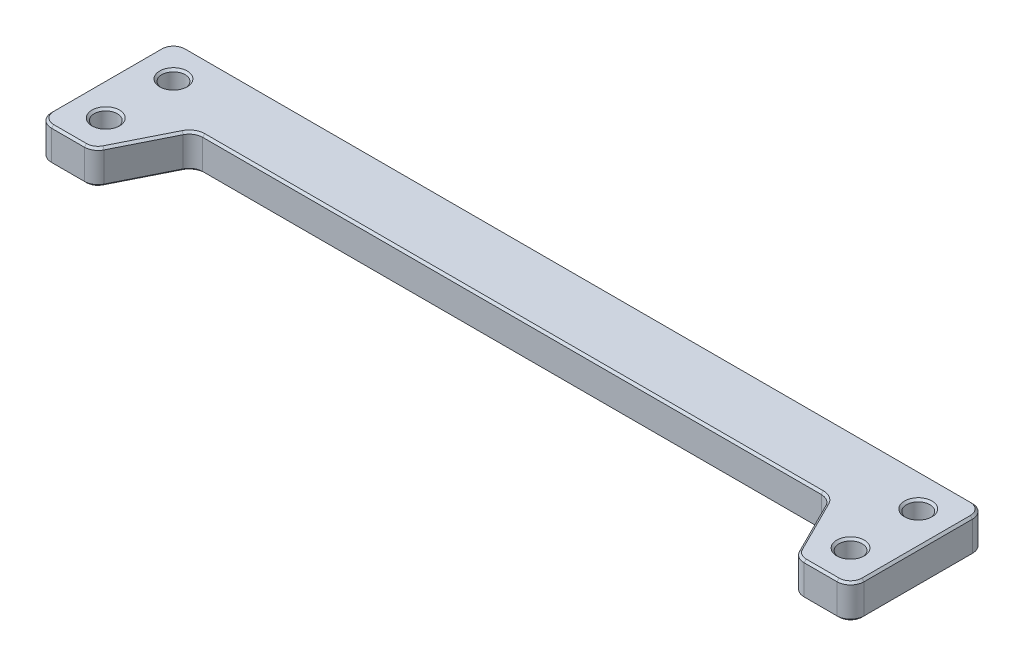
from build123d import *

# Parameters (mm, degrees)
SKETCH1_R           = 2.1828125
BOSS_EXTRUDE1_DEPTH = 6.35
CHAMFER1_SIZE       = 0.396875


with BuildPart() as part:
    # Sketch1 → Boss-Extrude1 (new body)
    with BuildSketch(Plane(origin=(0, 0, 0), x_dir=(1, 0, 0), z_dir=(0, 1, 0))):
        with BuildLine():
            Line((-3.81, 19.05), (143.51, 19.05))
            ThreePointArc((143.51, 19.05), (145.306051224, 18.306051224), (146.05, 16.51))
            Line((146.05, 16.51), (146.05, -3.81))
            ThreePointArc((146.05, -3.81), (145.306051224, -5.606051224), (143.51, -6.35))
            Line((143.51, -6.35), (137.345290503, -6.35))
            ThreePointArc((137.345290503, -6.35), (136.009933478, -5.970653053), (135.073445438, -4.945922533))
            Line((135.073445438, -4.945922533), (130.127522905, 4.945922533))
            ThreePointArc((130.127522905, 4.945922533), (129.191034865, 5.970653053), (127.85567784, 6.35))
            Line((127.85567784, 6.35), (11.84432216, 6.35))
            ThreePointArc((11.84432216, 6.35), (10.508965135, 5.970653053), (9.572477095, 4.945922533))
            Line((9.572477095, 4.945922533), (4.626554562, -4.945922533))
            ThreePointArc((4.626554562, -4.945922533), (3.690066522, -5.970653053), (2.354709497, -6.35))
            Line((2.354709497, -6.35), (-3.81, -6.35))
            ThreePointArc((-3.81, -6.35), (-5.606051224, -5.606051224), (-6.35, -3.81))
            Line((-6.35, -3.81), (-6.35, 16.51))
            ThreePointArc((-6.35, 16.51), (-5.606051224, 18.306051224), (-3.81, 19.05))
        make_face()
        Circle(SKETCH1_R, mode=Mode.SUBTRACT)
        with Locations((0, 12.7)):
            Circle(SKETCH1_R, mode=Mode.SUBTRACT)
        with Locations((139.7, 12.7)):
            Circle(SKETCH1_R, mode=Mode.SUBTRACT)
        with Locations((139.7, 0)):
            Circle(SKETCH1_R, mode=Mode.SUBTRACT)
    extrude(amount=BOSS_EXTRUDE1_DEPTH)

    # Chamfer1
    chamfer1_edges = [part.edges().sort_by_distance(p)[0] for p in [
        (137.5171875, 0, 0),
        (137.5171875, 0, -12.7),
        (-2.1828125, 0, -12.7),
        (-2.1828125, 0, 0),
        (132.600484171, 0, 0),
        (136.009933478, 0, 5.970653053),
        (140.427645251, 0, 6.35),
        (145.306051224, 0, 5.606051224),
        (146.05, 0, -6.35),
        (145.306051224, 0, -18.306051224),
        (69.85, 0, -19.05),
        (-5.606051224, 0, -18.306051224),
        (-6.35, 0, -6.35),
        (-5.606051224, 0, 5.606051224),
        (-0.727645251, 0, 6.35),
        (3.690066522, 0, 5.970653053),
        (7.099515829, 0, 0),
        (10.508965135, 0, -5.970653053),
        (69.85, 0, -6.35),
        (129.191034865, 0, -5.970653053),
        (137.5171875, 6.35, 0),
        (-2.1828125, 6.35, -12.7),
        (69.85, 6.35, -6.35),
        (10.508965135, 6.35, -5.970653053),
        (7.099515829, 6.35, 0),
        (3.690066522, 6.35, 5.970653053),
        (-0.727645251, 6.35, 6.35),
        (-5.606051224, 6.35, 5.606051224),
        (-6.35, 6.35, -6.35),
        (-5.606051224, 6.35, -18.306051224),
        (69.85, 6.35, -19.05),
        (145.306051224, 6.35, -18.306051224),
        (146.05, 6.35, -6.35),
        (145.306051224, 6.35, 5.606051224),
        (140.427645251, 6.35, 6.35),
        (136.009933478, 6.35, 5.970653053),
        (132.600484171, 6.35, 0),
        (129.191034865, 6.35, -5.970653053),
        (-2.1828125, 6.35, 0),
        (137.5171875, 6.35, -12.7),
    ]]
    chamfer(chamfer1_edges, length=CHAMFER1_SIZE)


solid = part.part
